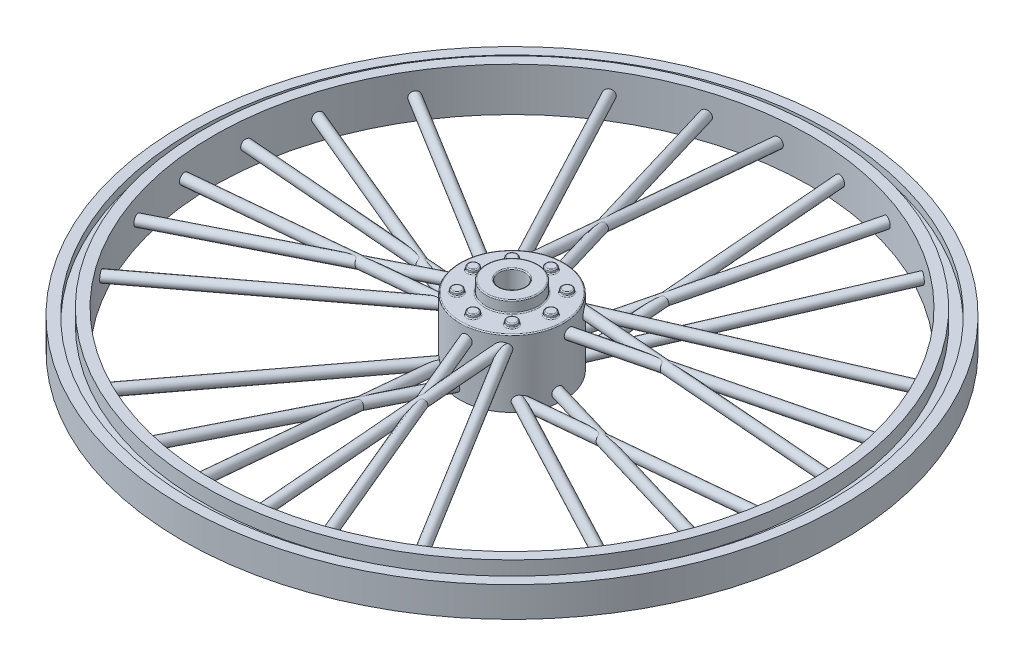
from build123d import *

# Parameters (mm, degrees)
BOSS_EXTRUDE1_START      = -3.1
SKETCH2_R                = 5
BOSS_EXTRUDE1_DEPTH      = 6.5
SWEEP1_PROFILE_R         = 0.5
SWEEP2_PROFILE_R         = 0.5
SWEEP3_PROFILE_R         = 0.5
SWEEP4_PROFILE_R         = 0.5
SWEEP5_PROFILE_R         = 0.5
SWEEP6_PROFILE_R         = 0.5
CIRPATTERN1_COUNT        = 4
SKETCH9_R                = 4
CUT_EXTRUDE1_DEPTH       = 5
BOSS_EXTRUDE2_DEPTH      = 5
SKETCH11_R               = 2.5
BOSS_EXTRUDE3_DEPTH      = 1.1
SKETCH12_R               = 1.25
CUT_EXTRUDE2_DEPTH       = 46.539927553
SKETCH13_R               = 0.5
BOSS_EXTRUDE4_DEPTH      = 0.35
FILLET2_R                = 0.1
FILLET3_R                = 0.1
CIRPATTERN3_COUNT        = 8
FILLET3_OF_CIRPATTERN3_R = 0.1
FILLET4_R                = 0.5


with BuildPart() as part:
    # Sketch1 → Revolve2 (revolve)
    with BuildSketch(Plane(origin=(0, 0, 0), x_dir=(0, 0, -1), z_dir=(1, 0, 0))):
        Polygon((30.75, 1.45), (31.75, 1.45), (31.75, -1.45), (30.75, -1.45), (30.75, -0.7), (29.75, -0.7), (29.75, -2.1), (28.75, -2.1), (28.75, 2.1), (29.75, 2.1), (29.75, 0.7), (30.75, 0.7), align=None)
    revolve(axis=Axis((0, 0, 0), (0, 1, 0)))



with BuildPart() as body_2:
    # Sketch2 → Boss-Extrude1 (new body)
    with BuildSketch(Plane(origin=(0, 0, 0), x_dir=(1, 0, 0), z_dir=(0, 1, 0)).offset(BOSS_EXTRUDE1_START)):
        with Locations(Location((0, 0, 0), (0, 0, 90))):
            Circle(SKETCH2_R)
    extrude(amount=BOSS_EXTRUDE1_DEPTH)


with BuildPart() as part_1:
    add(part.part)

    add(body_2.part)  # Sweep1 merges body 2
    # Sweep1: sweep along a path in Sketch3
    with BuildLine(Plane(origin=(3, 0, 0), x_dir=(0, 0, -1), z_dir=(1, 0, 0))) as sweep1_path:
        Line((-29.598352995, 0), (0, 2.589520346))
    # Sweep1 profile (on start of the path) → Sweep1 (sweep)
    with BuildSketch(Plane(origin=(3, 0, 29.598352995), x_dir=(0, -0.9961946980917455, -0.08715574274765832), z_dir=(0, 0.08715574274765832, -0.9961946980917455))):
        Circle(SWEEP1_PROFILE_R)
    sweep1 = sweep(path=sweep1_path.line)

    # Sweep2: sweep along a path in Sketch4
    with BuildLine(Plane(origin=(-1.109703818, 0, 0.403899159), x_dir=(0.3420201433256631, 0, 0.9396926207859105), z_dir=(-0.9396926207859104, 0, 0.34202014332566305))) as sweep2_path:
        Line((29.726552489, 0), (0, 2.600736349))
    # Sweep2 profile (on start of the path) → Sweep2 (sweep)
    with BuildSketch(Plane(origin=(9.057375925, 0, 28.337721174), x_dir=(-0.9396926207859104, 0, 0.3420201433256631), z_dir=(-0.3407186534216045, 0.08715574274765824, -0.9361168066628612))):
        Circle(SWEEP2_PROFILE_R)
    sweep2 = sweep(path=sweep2_path.line)

    # Sweep3: sweep along a path in Sketch5
    with BuildLine(Plane(origin=(0.734455543, 0, -0.424038106), x_dir=(-0.500000000000001, 0, -0.866025403784438), z_dir=(0.866025403784438, 0, -0.500000000000001))) as sweep3_path:
        Line((-29.737909589, 0), (0, 2.601729966))
    # Sweep3 profile (on start of the path) → Sweep3 (sweep)
    with BuildSketch(Plane(origin=(15.603410338, 0, 25.329747054), x_dir=(-0.866025403784438, 0, 0.500000000000001), z_dir=(-0.49809734904587377, 0.08715574274765832, -0.8627299156628203))):
        Circle(SWEEP3_PROFILE_R)
    sweep3 = sweep(path=sweep3_path.line)

    # Sweep4: sweep along a path in Sketch6
    with BuildLine(Plane(origin=(3, 0, 0), x_dir=(0, 0, -1), z_dir=(1, 0, 0))) as sweep4_path:
        Line((0, -2.589520346), (29.598352995, 0))
    # Sweep4 profile (on start of the path) → Sweep4 (sweep)
    with BuildSketch(Plane(origin=(3, -2.589520346, 0), x_dir=(0, -0.9961946980917462, -0.0871557427476517), z_dir=(0, 0.0871557427476517, -0.9961946980917462))):
        Circle(SWEEP4_PROFILE_R)
    sweep4 = sweep(path=sweep4_path.line)

    # Sweep5: sweep along a path in Sketch7
    with BuildLine(Plane(origin=(-1.109703818, 0, -0.403899159), x_dir=(0.34202014332566943, 0, -0.9396926207859081), z_dir=(0.9396926207859081, 0, 0.34202014332566943))) as sweep5_path:
        Line((29.726552489, 0), (0, -2.600736349))
    # Sweep5 profile (on start of the path) → Sweep5 (sweep)
    with BuildSketch(Plane(origin=(9.057375925, 0, -28.337721174), x_dir=(0.9396926207859082, 0, 0.34202014332566943), z_dir=(-0.340718653421611, -0.08715574274765156, 0.9361168066628595))):
        Circle(SWEEP5_PROFILE_R)
    sweep5 = sweep(path=sweep5_path.line)

    # Sweep6: sweep along a path in Sketch8
    with BuildLine(Plane(origin=(0.734455543, 0, 0.424038106), x_dir=(-0.49999999999999495, 0, 0.8660254037844416), z_dir=(-0.8660254037844416, 0, -0.49999999999999495))) as sweep6_path:
        Line((-29.737909589, 0), (0, -2.601729966))
    # Sweep6 profile (on start of the path) → Sweep6 (sweep)
    with BuildSketch(Plane(origin=(15.603410338, 0, -25.329747054), x_dir=(0.8660254037844416, 0, 0.4999999999999949), z_dir=(-0.498097349045868, -0.08715574274765119, 0.8627299156628243))):
        Circle(SWEEP6_PROFILE_R)
    sweep6 = sweep(path=sweep6_path.line)

    # CirPattern1: Sweep1, Sweep2, Sweep3, Sweep4, Sweep5, Sweep6 ×4 about axis
    cirpattern1_axis = Axis((0, 3.4, 0), (0, 1, 0))
    add([sweep1.rotate(cirpattern1_axis, i * 360 / CIRPATTERN1_COUNT) for i in range(1, CIRPATTERN1_COUNT)])
    add([sweep2.rotate(cirpattern1_axis, i * 360 / CIRPATTERN1_COUNT) for i in range(1, CIRPATTERN1_COUNT)])
    add([sweep3.rotate(cirpattern1_axis, i * 360 / CIRPATTERN1_COUNT) for i in range(1, CIRPATTERN1_COUNT)])
    add([sweep4.rotate(cirpattern1_axis, i * 360 / CIRPATTERN1_COUNT) for i in range(1, CIRPATTERN1_COUNT)])
    add([sweep5.rotate(cirpattern1_axis, i * 360 / CIRPATTERN1_COUNT) for i in range(1, CIRPATTERN1_COUNT)])
    add([sweep6.rotate(cirpattern1_axis, i * 360 / CIRPATTERN1_COUNT) for i in range(1, CIRPATTERN1_COUNT)])

    # Sketch9 → Cut-Extrude1 (cut)
    with BuildSketch(Plane.XZ.offset(3.1)):
        with Locations(Location((0, 0, 0), (0, 0, 270))):
            Circle(SKETCH9_R)
    extrude(amount=-CUT_EXTRUDE1_DEPTH, mode=Mode.SUBTRACT)

    # Sketch10 → Boss-Extrude2 (add)
    with BuildSketch(Plane.XZ.offset(-1.9)):
        Polygon((-2, 1.154700538), (-2, -1.154700538), (0, -2.309401077), (2, -1.154700538), (2, 1.154700538), (0, 2.309401077), align=None)
    extrude(amount=BOSS_EXTRUDE2_DEPTH)

    # Sketch11 → Boss-Extrude3 (add)
    with BuildSketch(Plane(origin=(0, 3.4, 0), x_dir=(1, 0, 0), z_dir=(0, 1, 0))):
        with Locations(Location((0, 0, 0), (0, 0, 270))):
            Circle(SKETCH11_R)
    extrude(amount=BOSS_EXTRUDE3_DEPTH)

    # Sketch12 → Cut-Extrude2 (cut, through all)
    with BuildSketch(Plane(origin=(0, 4.5, 0), x_dir=(1, 0, 0), z_dir=(0, 1, 0))):
        with Locations(Location((0, 0, 0), (0, 0, 270))):
            Circle(SKETCH12_R)
    extrude(amount=-CUT_EXTRUDE2_DEPTH, mode=Mode.SUBTRACT)

    # Sketch13 → Boss-Extrude4 (add)
    with BuildSketch(Plane(origin=(0, 3.4, 0), x_dir=(1, 0, 0), z_dir=(0, 1, 0))):
        with Locations(Location((-3.75, 0, 0), (0, 0, 270))):
            Circle(SKETCH13_R)
    boss_extrude4 = extrude(amount=BOSS_EXTRUDE4_DEPTH)

    # Fillet2
    fillet2_edges = [part_1.edges().sort_by_distance(p)[0] for p in [
        (1, -3.1, 1.732050808),
        (2, -3.1, 0),
        (1, -3.1, -1.732050808),
        (-1, -3.1, -1.732050808),
        (-2, -3.1, 0),
        (-1, -3.1, 1.732050808),
        (0, 3.4, -2.5),
        (0, 4.5, -2.5),
        (0, -3.1, -1.25),
        (0, 4.5, -1.25),
        (0, 3.4, 5),
    ]]
    fillet(fillet2_edges, radius=FILLET2_R)

    # Fillet3
    fillet3_edges = [part_1.edges().sort_by_distance(p)[0] for p in [
        (-3.75, 3.4, -0.5),
        (-3.75, 3.75, -0.5),
    ]]
    fillet(fillet3_edges, radius=FILLET3_R)

    # CirPattern3: Boss-Extrude4 ×8 about axis
    cirpattern3_axis = Axis((0, 0, 0), (0, 1, 0))
    for i in range(1, CIRPATTERN3_COUNT):
        add(boss_extrude4.rotate(cirpattern3_axis, i * 360 / CIRPATTERN3_COUNT))

    # Fillet3 of CirPattern3
    fillet3_of_cirpattern3_edges = [part_1.edges().sort_by_distance(p)[0] for p in [
        (-3.00520382, 3.4, 2.298097039),
        (-3.00520382, 3.75, 2.298097039),
        (-0.5, 3.4, 3.75),
        (-0.5, 3.75, 3.75),
        (2.298097039, 3.4, 3.00520382),
        (2.298097039, 3.75, 3.00520382),
        (3.75, 3.4, 0.5),
        (3.75, 3.75, 0.5),
        (3.00520382, 3.4, -2.298097039),
        (3.00520382, 3.75, -2.298097039),
        (0.5, 3.4, -3.75),
        (0.5, 3.75, -3.75),
        (-2.298097039, 3.4, -3.00520382),
        (-2.298097039, 3.75, -3.00520382),
    ]]
    fillet(fillet3_of_cirpattern3_edges, radius=FILLET3_OF_CIRPATTERN3_R)

    # Fillet4
    # the kernel refuses this fillet: 0.5 mm, written as the material it takes off along each edge
    with BuildSketch(Plane(origin=(0, -3.1, -1.732050808), x_dir=(-0.5000000000000001, 0, -0.8660254037844386), z_dir=(-0.8660254037844386, 0, 0.5000000000000001))) as fillet4_piece_1:
        with BuildLine():
            CenterArc((0.4, -0.1), 0.1, 0, 90)
            Line((0.5, -0.1), (0.5, 0))
            Line((0.5, 0), (0.4, 0))
        make_face()
    fillet4_piece_1_solid = revolve(axis=Axis((0, -3.1, -1.732050808), (0, -1, 0)), revolution_arc=60, mode=Mode.PRIVATE)
    with BuildSketch(Plane(origin=(1.5, -3.1, -0.866025404), x_dir=(0.5000000000000003, 0, -0.8660254037844385), z_dir=(-0.8660254037844385, 0, -0.5000000000000003))) as fillet4_piece_2:
        with BuildLine():
            CenterArc((0.4, -0.1), 0.1, 0, 90)
            Line((0.5, -0.1), (0.5, 0))
            Line((0.5, 0), (0.4, 0))
        make_face()
    fillet4_piece_2_solid = revolve(axis=Axis((1.5, -3.1, -0.866025404), (0, -1, 0)), revolution_arc=60, mode=Mode.PRIVATE)
    with BuildSketch(Plane(origin=(-1.5, -3.1, -0.866025404), x_dir=(-1, 0, 0), z_dir=(0, 0, 1))) as fillet4_piece_3:
        with BuildLine():
            CenterArc((0.4, -0.1), 0.1, 0, 90)
            Line((0.5, -0.1), (0.5, 0))
            Line((0.5, 0), (0.4, 0))
        make_face()
    fillet4_piece_3_solid = revolve(axis=Axis((-1.5, -3.1, -0.866025404), (0, -1, 0)), revolution_arc=60, mode=Mode.PRIVATE)
    with BuildSketch(Plane(origin=(1.5, -3.1, 0.866025404), x_dir=(1, 0, 0), z_dir=(0, 0, -1))) as fillet4_piece_4:
        with BuildLine():
            CenterArc((0.4, -0.1), 0.1, 0, 90)
            Line((0.5, -0.1), (0.5, 0))
            Line((0.5, 0), (0.4, 0))
        make_face()
    fillet4_piece_4_solid = revolve(axis=Axis((1.5, -3.1, 0.866025404), (0, -1, 0)), revolution_arc=60, mode=Mode.PRIVATE)
    with BuildSketch(Plane(origin=(-1.5, -3.1, 0.866025404), x_dir=(-0.5000000000000001, 0, 0.8660254037844387), z_dir=(0.8660254037844387, 0, 0.5000000000000001))) as fillet4_piece_5:
        with BuildLine():
            CenterArc((0.4, -0.1), 0.1, 0, 90)
            Line((0.5, -0.1), (0.5, 0))
            Line((0.5, 0), (0.4, 0))
        make_face()
    fillet4_piece_5_solid = revolve(axis=Axis((-1.5, -3.1, 0.866025404), (0, -1, 0)), revolution_arc=60, mode=Mode.PRIVATE)
    with BuildSketch(Plane(origin=(0, -3.1, 1.732050808), x_dir=(0.5000000000000001, 0, 0.8660254037844387), z_dir=(0.8660254037844387, 0, -0.5000000000000001))) as fillet4_piece_6:
        with BuildLine():
            CenterArc((0.4, -0.1), 0.1, 0, 90)
            Line((0.5, -0.1), (0.5, 0))
            Line((0.5, 0), (0.4, 0))
        make_face()
    fillet4_piece_6_solid = revolve(axis=Axis((0, -3.1, 1.732050808), (0, -1, 0)), revolution_arc=60, mode=Mode.PRIVATE)
    with BuildSketch(Plane(origin=(-2, 1.9, 1.154700538), x_dir=(0, 0, -1), z_dir=(0, -1, 0))) as fillet4_piece_7:
        with BuildLine():
            CenterArc((FILLET4_R * 0.57735026919, FILLET4_R), FILLET4_R, 210, 60)
            Line((-FILLET4_R * 0.288675134595, FILLET4_R * 0.5), (0, 0))
            Line((0, 0), (FILLET4_R * 0.57735026919, 0))
        make_face()
    fillet4_piece_7_solid = extrude(amount=5, mode=Mode.PRIVATE)
    with BuildSketch(Plane(origin=(0, 1.9, 2.309401077), x_dir=(0.8660254037844392, 0, -0.4999999999999992), z_dir=(0, -1, 0)), Plane(origin=(2, 1.9, 1.154700538), x_dir=(0, 0, -1), z_dir=(0, -1, 0)), Plane(origin=(2, 1.9, -1.154700538), x_dir=(-0.8660254037844386, 0, -0.5000000000000001), z_dir=(0, -1, 0)), Plane(origin=(0, 1.9, -2.309401077), x_dir=(-0.8660254037844386, 0, 0.5), z_dir=(0, -1, 0)), Plane(origin=(-2, 1.9, -1.154700538), x_dir=(0, 0, 1), z_dir=(0, -1, 0))) as fillet4_piece_8:
        with BuildLine():
            CenterArc((FILLET4_R * 0.57735026919, -FILLET4_R), FILLET4_R, 90, 60)
            Line((-FILLET4_R * 0.288675134595, -FILLET4_R * 0.5), (0, 0))
            Line((0, 0), (FILLET4_R * 0.57735026919, 0))
        make_face()
    fillet4_piece_8_solid = extrude(amount=5, mode=Mode.PRIVATE)
    add([fillet4_piece_1_solid, fillet4_piece_2_solid, fillet4_piece_3_solid, fillet4_piece_4_solid, fillet4_piece_5_solid, fillet4_piece_6_solid, fillet4_piece_7_solid, fillet4_piece_8_solid], mode=Mode.SUBTRACT)


solid = part_1.part
